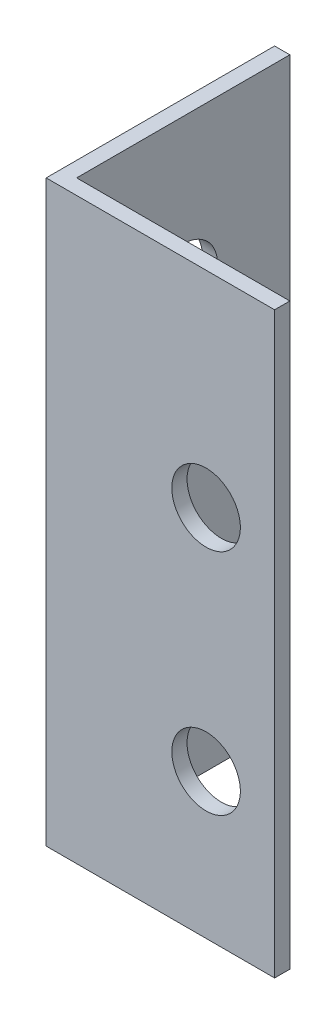
from build123d import *

# Parameters (mm, degrees)
EXTRUDE_1_DEPTH     = 38
SKETCH_2_R          = 2.25
CUT_EXTRUDE_1_DEPTH = 44.185645763
SKETCH_3_R          = 2.25
CUT_EXTRUDE_2_DEPTH = 44.185645763
SKETCH_4_R          = 2.25
CUT_EXTRUDE_3_DEPTH = 44.185645763
SKETCH_5_R          = 2.25
CUT_EXTRUDE_4_DEPTH = 44.185645763


with BuildPart() as part:
    # Эскиз1 → Бобышка-Вытянуть1 (new body)
    with BuildSketch(Plane(origin=(0, 0, 0), x_dir=(1, 0, 0), z_dir=(0, 1, 0))):
        Polygon((0, 0), (0, 15), (1, 15), (1, 1), (15, 1), (15, 0), align=None)
    extrude(amount=EXTRUDE_1_DEPTH)

    # Эскиз2 → Вырез-Вытянуть1 (cut, through all)
    with BuildSketch(Plane(origin=(0, 0, -1), x_dir=(-1, 0, 0), z_dir=(0, 0, -1))):
        with Locations((-10.5, 9.5)):
            Circle(SKETCH_2_R)
    extrude(amount=-CUT_EXTRUDE_1_DEPTH, mode=Mode.SUBTRACT)

    # Эскиз3 → Вырез-Вытянуть2 (cut, through all)
    with BuildSketch(Plane(origin=(0, 0, -1), x_dir=(-1, 0, 0), z_dir=(0, 0, -1))):
        with Locations((-10.5, 24.5)):
            Circle(SKETCH_3_R)
    extrude(amount=-CUT_EXTRUDE_2_DEPTH, mode=Mode.SUBTRACT)

    # Эскиз4 → Вырез-Вытянуть3 (cut, through all)
    with BuildSketch(Plane(origin=(1, 0, 0), x_dir=(0, 0, -1), z_dir=(1, 0, 0))):
        with Locations((8, 28.5)):
            Circle(SKETCH_4_R)
    extrude(amount=-CUT_EXTRUDE_3_DEPTH, mode=Mode.SUBTRACT)

    # Эскиз5 → Вырез-Вытянуть4 (cut, through all)
    with BuildSketch(Plane(origin=(1, 0, 0), x_dir=(0, 0, -1), z_dir=(1, 0, 0))):
        with Locations((8, 9.5)):
            Circle(SKETCH_5_R)
    extrude(amount=-CUT_EXTRUDE_4_DEPTH, mode=Mode.SUBTRACT)


solid = part.part
